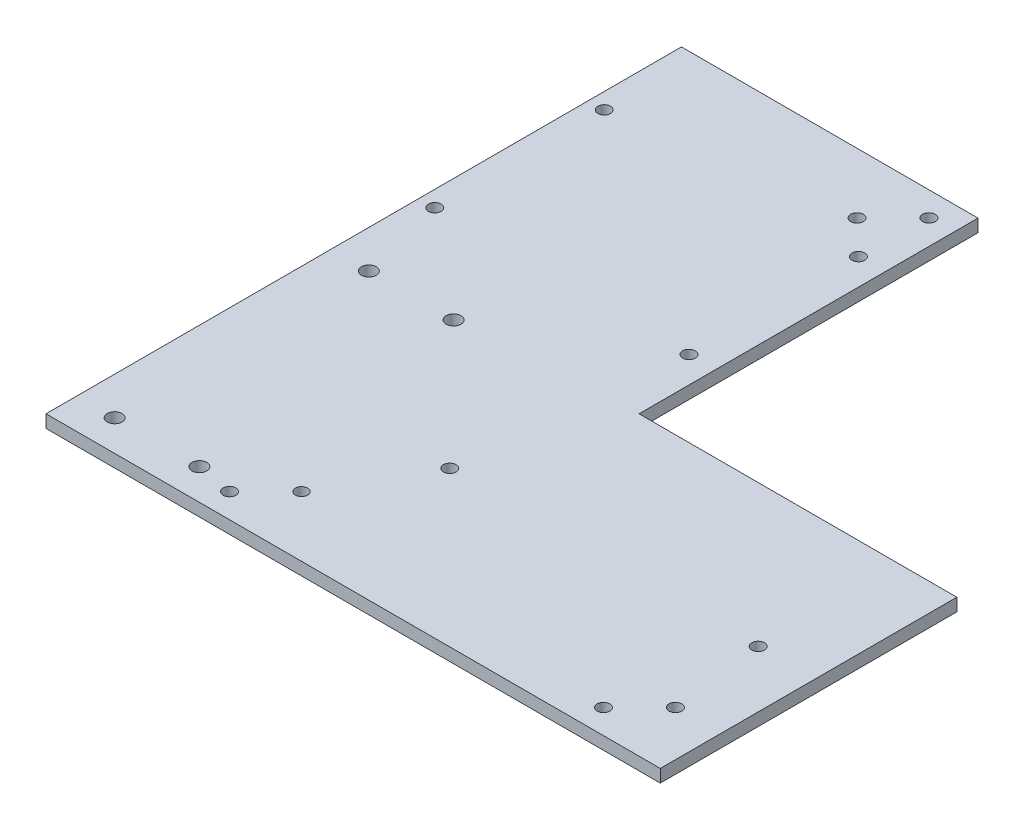
from build123d import *

# Parameters (mm, degrees)
SKETCH1_R           = 1.5
SKETCH1_R_2         = 1.44463942
SKETCH1_R_3         = 1.75
BOSS_EXTRUDE1_DEPTH = 3


with BuildPart() as part:
    # Sketch1 → Boss-Extrude1 (new body)
    with BuildSketch(Plane(origin=(0, 0, 0), x_dir=(1, 0, 0), z_dir=(0, 1, 0))):
        Polygon((-72.5, -35), (72.5, -35), (72.5, 35), (-2.5, 35), (-2.5, 115), (-72.5, 115), (-72.5, 35), align=None)
        with Locations((-34.926368805, -29.242640687)):
            Circle(SKETCH1_R, mode=Mode.SUBTRACT)
        with Locations((-26.441087431, -20.757359313)):
            Circle(SKETCH1_R_2, mode=Mode.SUBTRACT)
        with Locations((53.338095075, -29.242640687)):
            Circle(SKETCH1_R, mode=Mode.SUBTRACT)
        with Locations((61.823376449, -20.757359313)):
            Circle(SKETCH1_R, mode=Mode.SUBTRACT)
        with Locations((-16.814355015, 100.757359313)):
            Circle(SKETCH1_R, mode=Mode.SUBTRACT)
        with Locations((-8.329073641, 109.242640687)):
            Circle(SKETCH1_R, mode=Mode.SUBTRACT)
        with Locations((-13.69982199, 1.5)):
            Circle(SKETCH1_R, mode=Mode.SUBTRACT)
        with Locations((59.109237961, 1.5)):
            Circle(SKETCH1_R, mode=Mode.SUBTRACT)
        with Locations((-63.584566194, -27.710636817)):
            Circle(SKETCH1_R_3, mode=Mode.SUBTRACT)
        with Locations((-43.584566194, -27.710636817)):
            Circle(SKETCH1_R_3, mode=Mode.SUBTRACT)
        with Locations((-43.584566194, 32.289363183)):
            Circle(SKETCH1_R_3, mode=Mode.SUBTRACT)
        with Locations((-63.584566194, 32.289363183)):
            Circle(SKETCH1_R_3, mode=Mode.SUBTRACT)
        with Locations((-68.740395312, 53.009730632)):
            Circle(SKETCH1_R, mode=Mode.SUBTRACT)
        with Locations((-68.740395312, 93.009730632)):
            Circle(SKETCH1_R, mode=Mode.SUBTRACT)
        with Locations((-8.740395312, 93.009730632)):
            Circle(SKETCH1_R, mode=Mode.SUBTRACT)
        with Locations((-8.740395312, 53.009730632)):
            Circle(SKETCH1_R, mode=Mode.SUBTRACT)
    extrude(amount=BOSS_EXTRUDE1_DEPTH)


solid = part.part
